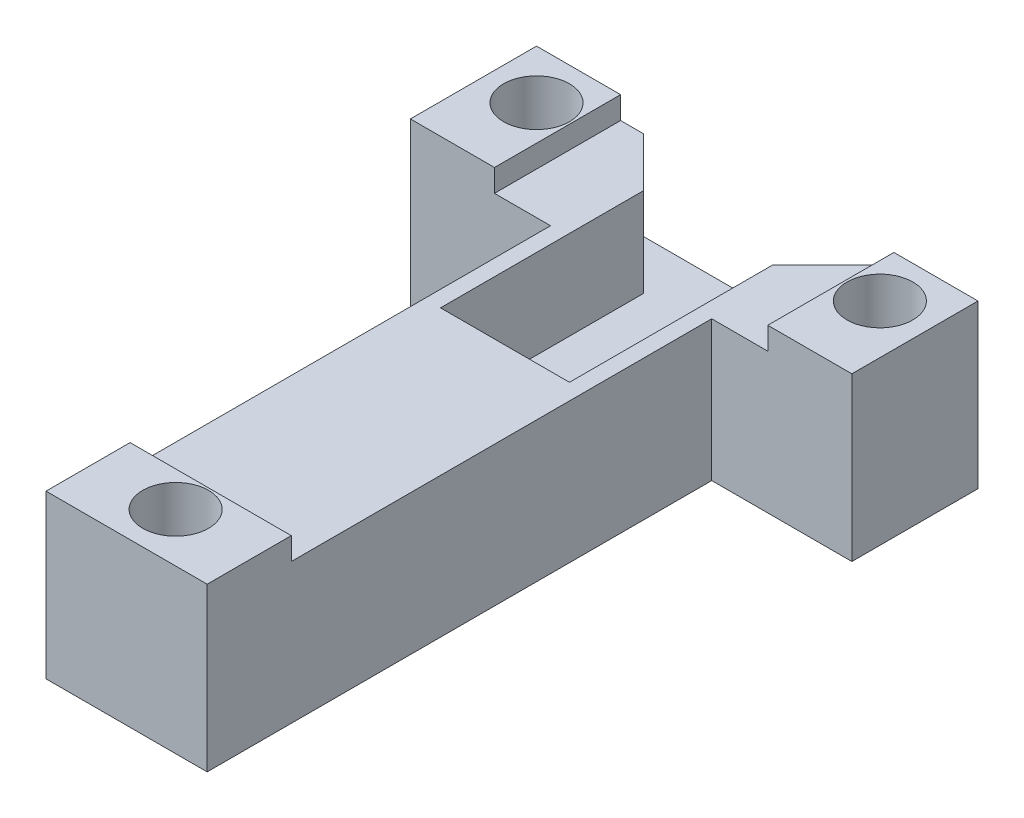
from build123d import *

# Parameters (mm, degrees)
BOSS_EXTRUDE1_DEPTH = 10
SKETCH2_R           = 2.3495
CUT_EXTRUDE1_DEPTH  = 6.35
SKETCH3_R           = 2.3495
CUT_EXTRUDE2_DEPTH  = 6.35
BOSS_EXTRUDE2_START = 1.6
SKETCH4_W           = 6
SKETCH4_H           = 9
SKETCH4_R           = 2.3495
SKETCH4_W_2         = 11.5
SKETCH4_H_2         = 6
BOSS_EXTRUDE2_DEPTH = 1.6


with BuildPart() as part:
    # Sketch1 → Boss-Extrude1 (new body)
    with BuildSketch(Plane(origin=(0, 0, 0), x_dir=(1, 0, 0), z_dir=(0, 1, 0))):
        Polygon((11.5, 0), (11.5, 36), (21.5, 36), (21.5, 45), (-10, 45), (-10, 36), (0, 36), (0, 0), align=None)
    extrude(amount=BOSS_EXTRUDE1_DEPTH)

    # Sketch2 → Cut-Extrude1 (cut)
    with BuildSketch(Plane(origin=(0, 10, 0), x_dir=(1, 0, 0), z_dir=(0, 1, 0))):
        Polygon((1.15, 41.5), (1.15, 27), (5.75, 27), (10.35, 27), (10.35, 41.5), (13.85, 45), (-2.35, 45), align=None)
        with Locations((5.75, 3.5)):
            Circle(SKETCH2_R)
        with Locations((-6.5, 41.5)):
            Circle(SKETCH2_R)
        with Locations((18, 41.5)):
            Circle(SKETCH2_R)
    extrude(amount=-CUT_EXTRUDE1_DEPTH, mode=Mode.SUBTRACT)

    # Sketch3 → Cut-Extrude2 (cut)
    with BuildSketch(Plane.XZ):
        with Locations((5.75, -10)):
            Circle(SKETCH3_R)
        with Locations((5.75, -22)):
            Circle(SKETCH3_R)
    extrude(amount=-CUT_EXTRUDE2_DEPTH, mode=Mode.SUBTRACT)

    # Sketch4 → Boss-Extrude2 (add)
    # profile 1 of 3: a face of its own
    with BuildSketch(Plane(origin=(0, 10, 0), x_dir=(1, 0, 0), z_dir=(0, 1, 0)).offset(BOSS_EXTRUDE2_START)):
        with Locations((-7, 40.5)):
            Rectangle(SKETCH4_W, SKETCH4_H)
        with Locations((-6.5, 41.5)):
            Circle(SKETCH4_R, mode=Mode.SUBTRACT)
    # profile 2 of 3: a face of its own
    with BuildSketch(Plane(origin=(0, 10, 0), x_dir=(1, 0, 0), z_dir=(0, 1, 0)).offset(BOSS_EXTRUDE2_START)):
        with Locations((18.5, 40.5)):
            Rectangle(SKETCH4_W, SKETCH4_H)
        with Locations((18, 41.5)):
            Circle(SKETCH4_R, mode=Mode.SUBTRACT)
    # profile 3 of 3: a face of its own
    with BuildSketch(Plane(origin=(0, 10, 0), x_dir=(1, 0, 0), z_dir=(0, 1, 0)).offset(BOSS_EXTRUDE2_START)):
        with Locations((5.75, 3)):
            Rectangle(SKETCH4_W_2, SKETCH4_H_2)
        with Locations((5.75, 3.5)):
            Circle(SKETCH4_R, mode=Mode.SUBTRACT)
    extrude(amount=-BOSS_EXTRUDE2_DEPTH)


solid = part.part
